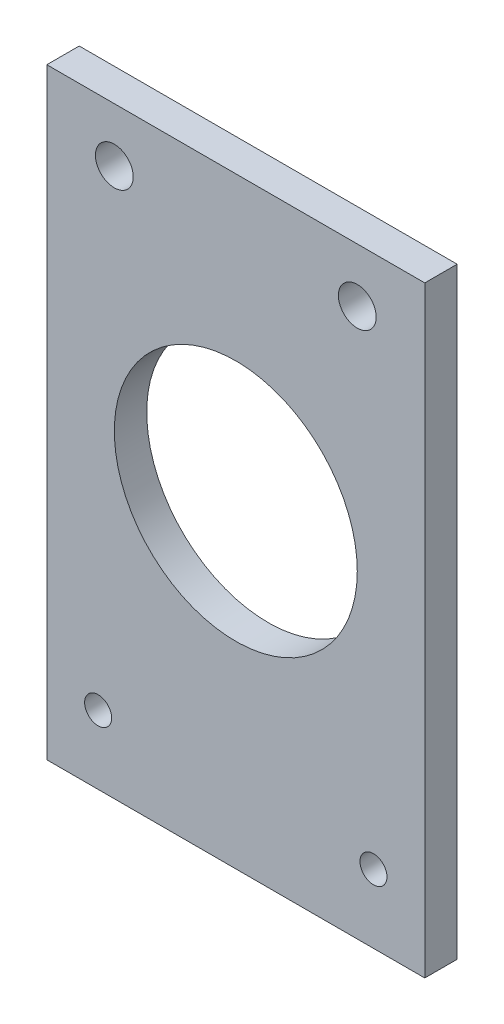
from build123d import *

# Parameters (mm, degrees)
SKETCH2_R           = 22.5
BOSS_EXTRUDE1_DEPTH = 3
SKETCH3_R           = 2.5
SKETCH3_R_2         = 3.5
CUT_EXTRUDE1_DEPTH  = 6


with BuildPart() as part:
    # Sketch2 → Boss-Extrude1 (new, symmetric)
    with BuildSketch(Plane.XY):
        Polygon((-35, 0), (35, 0), (35, 59), (35, 91.5), (35, 111.5), (-35, 111.5), (-35, 91.5), (-35, 59), align=None)
        with Locations((0, 59)):
            Circle(SKETCH2_R, mode=Mode.SUBTRACT)
    extrude(amount=BOSS_EXTRUDE1_DEPTH, both=True)

    # Sketch3 → Cut-Extrude1 (cut)
    with BuildSketch(Plane.XY.offset(3)):
        with Locations((-25.5, 12.7)):
            Circle(SKETCH3_R)
        with Locations((25.5, 12.7)):
            Circle(SKETCH3_R)
        with Locations((-22.5, 101.5)):
            Circle(SKETCH3_R_2)
        with Locations((22.5, 101.5)):
            Circle(SKETCH3_R_2)
    extrude(amount=-CUT_EXTRUDE1_DEPTH, mode=Mode.SUBTRACT)


solid = part.part
